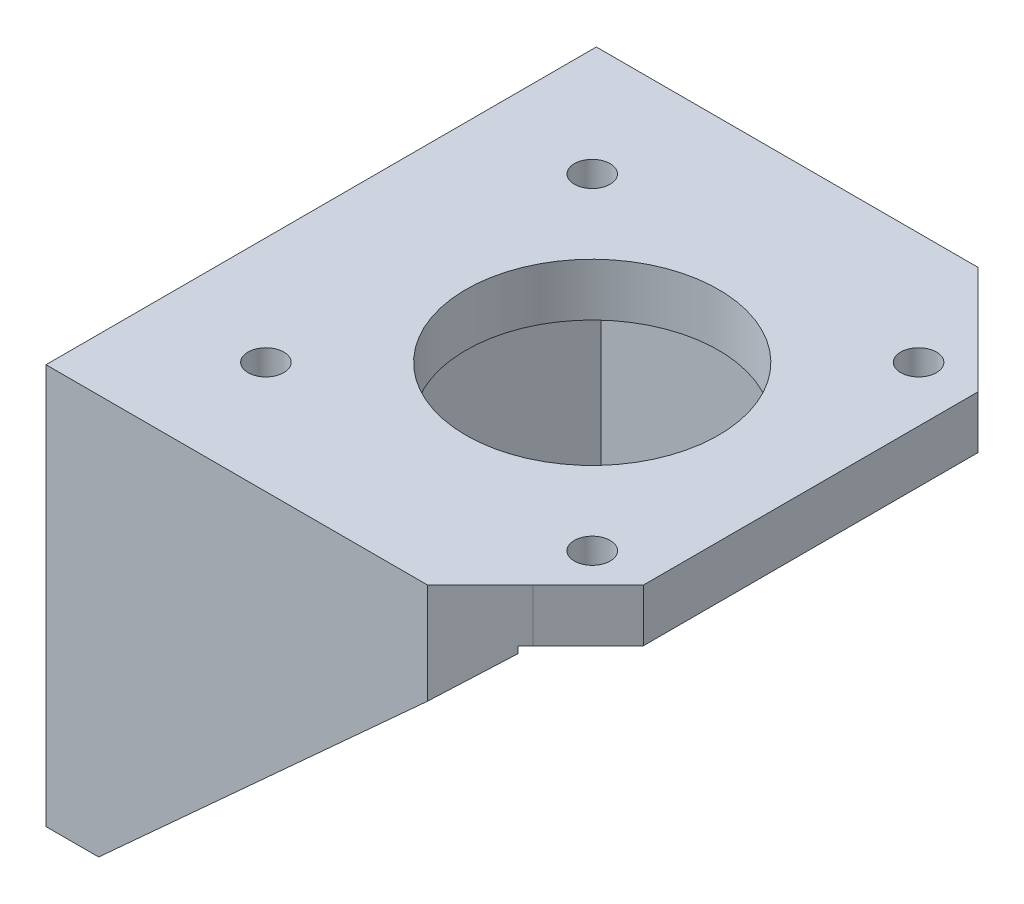
from build123d import *

# Parameters (mm, degrees)
SKETCH1_R                = 12
SKETCH1_R_2              = 1.7
BOSS_EXTRUDE1_DEPTH      = 5
BOSS_EXTRUDE3_DEPTH      = 5
BOSS_EXTRUDE4_DEPTH      = 5
CHAMFER1_SIZE            = 5
CHAMFER1_OF_MIRROR1_SIZE = 5
SKETCH7_R                = 3
CUT_EXTRUDE1_DEPTH       = 3.1
CUT_EXTRUDE2_DEPTH       = 33.001420077


# Read off the part's stored shape, not the designer's step: Cut-Extrude2
with BuildPart() as part:
    # Sketch1 → Boss-Extrude1 (new body)
    with BuildSketch(Plane(origin=(0, 0, 0), x_dir=(1, 0, 0), z_dir=(0, 1, 0))):
        Polygon((-20.75, 21.139640519), (-20.75, -21.139640519), (15.50680609, -21.139640519), (20.75, -15.896446609), (20.75, 15.896446609), (15.50680609, 21.139640519), align=None)
        with Locations(Location((0, 0, 0), (0, 0, 270))):
            Circle(SKETCH1_R, mode=Mode.SUBTRACT)
        with Locations(Location((15.5, 15.5, 0), (0, 0, 270))):
            Circle(SKETCH1_R_2, mode=Mode.SUBTRACT)
        with Locations(Location((-15.5, -15.5, 0), (0, 0, 270))):
            Circle(SKETCH1_R_2, mode=Mode.SUBTRACT)
        with Locations(Location((15.5, -15.5, 0), (0, 0, 270))):
            Circle(SKETCH1_R_2, mode=Mode.SUBTRACT)
        with Locations(Location((-15.5, 15.5, 0), (0, 0, 270))):
            Circle(SKETCH1_R_2, mode=Mode.SUBTRACT)
    extrude(amount=BOSS_EXTRUDE1_DEPTH)

    # Sketch3 → Boss-Extrude3 (add)
    with BuildSketch(Plane(origin=(-20.75, 0.364318818, 0), x_dir=(0, 0, 1), z_dir=(-1, 0, 0))):
        Polygon((-21.139640519, 4.635681182), (-21.139640519, 4.634261105), (-21.139640519, -0.364318818), (21.139640519, -0.364318818), (21.139640519, 4.634261105), (21.139640519, 4.635681182), align=None)
        with BuildLine():
            Line((21.139640519, -0.364318818), (-21.139640519, -0.364318818))
            Line((-21.139640519, -0.364318818), (-21.139640519, -5.366500535))
            Line((-21.139640519, -5.366500535), (-17.2, -5.366500535))
            ThreePointArc((-17.2, -5.366500535), (-15.5, -3.666500535), (-13.8, -5.366500535))
            Line((-13.8, -5.366500535), (13.8, -5.366500535))
            ThreePointArc((13.8, -5.366500535), (15.5, -3.666500535), (17.2, -5.366500535))
            Line((17.2, -5.366500535), (21.139640519, -5.366500535))
            Line((21.139640519, -5.366500535), (21.139640519, -0.364318818))
        make_face()
        with BuildLine():
            Line((-17.2, -5.366500535), (-21.139640519, -5.366500535))
            Line((-21.139640519, -5.366500535), (-21.139640519, -28.365738895))
            Line((-21.139640519, -28.365738895), (-17.2, -28.365738895))
            ThreePointArc((-17.2, -28.365738895), (-15.5, -26.665738895), (-13.8, -28.365738895))
            Line((-13.8, -28.365738895), (13.8, -28.365738895))
            ThreePointArc((13.8, -28.365738895), (15.5, -26.665738895), (17.2, -28.365738895))
            Line((17.2, -28.365738895), (21.139640519, -28.365738895))
            Line((21.139640519, -28.365738895), (21.139640519, -5.366500535))
            Line((21.139640519, -5.366500535), (17.2, -5.366500535))
            ThreePointArc((17.2, -5.366500535), (15.5, -7.066500535), (13.8, -5.366500535))
            Line((13.8, -5.366500535), (-13.8, -5.366500535))
            ThreePointArc((-13.8, -5.366500535), (-15.5, -7.066500535), (-17.2, -5.366500535))
        make_face()
        with BuildLine():
            Line((-17.2, -28.365738895), (-21.139640519, -28.365738895))
            Line((-21.139640519, -28.365738895), (-21.139640519, -33.365738895))
            Line((-21.139640519, -33.365738895), (21.139640519, -33.365738895))
            Line((21.139640519, -33.365738895), (21.139640519, -28.365738895))
            Line((21.139640519, -28.365738895), (17.2, -28.365738895))
            ThreePointArc((17.2, -28.365738895), (15.5, -30.065738895), (13.8, -28.365738895))
            Line((13.8, -28.365738895), (-13.8, -28.365738895))
            ThreePointArc((-13.8, -28.365738895), (-15.5, -30.065738895), (-17.2, -28.365738895))
        make_face()
    extrude(amount=BOSS_EXTRUDE3_DEPTH)

    # Sketch6 → Boss-Extrude4 (add)
    with BuildSketch(Plane(origin=(0, 0, -21.139640519), x_dir=(-1, 0, 0), z_dir=(0, 0, -1))):
        Polygon((-15.50680609, 0), (20.75, -33.001420077), (25.75, -33.001420077), (25.75, 5), (-15.50680609, 5), align=None)
    boss_extrude4 = extrude(amount=BOSS_EXTRUDE4_DEPTH)

    # Chamfer1
    chamfer1_edges = [part.edges().sort_by_distance(p)[0] for p in [
        (15.50680609, 2.5, -26.139640519),
    ]]
    chamfer(chamfer1_edges, length=CHAMFER1_SIZE - 0.0001)  # a hair under: the kernel refuses the full size

    # Mirror1: Boss-Extrude4 across plane
    add(boss_extrude4.mirror(Plane(origin=(0, 0, 0), x_dir=(1, 0, 0), z_dir=(0, 0, -1))))

    # Chamfer1 of Mirror1
    chamfer1_of_mirror1_edges = [part.edges().sort_by_distance(p)[0] for p in [
        (15.50680609, 2.5, 26.139640519),
    ]]
    chamfer(chamfer1_of_mirror1_edges, length=CHAMFER1_OF_MIRROR1_SIZE - 0.0001)  # a hair under: the kernel refuses the full size

    # Sketch7 → Cut-Extrude1 (cut)
    with BuildSketch(Plane(origin=(-20.75, 0, 0), x_dir=(0, 0, -1), z_dir=(1, 0, 0))):
        with Locations((-15.5, -5.002181717)):
            Circle(SKETCH7_R)
        with Locations((15.5, -5.002181717)):
            Circle(SKETCH7_R)
        with Locations((-15.5, -28.001420077)):
            Circle(SKETCH7_R)
        with Locations((15.5, -28.001420077)):
            Circle(SKETCH7_R)
    extrude(amount=-CUT_EXTRUDE1_DEPTH, mode=Mode.SUBTRACT)

    # Cut-Extrude2 outline → Cut-Extrude2 (cut)
    with BuildSketch(Plane.XZ):
        Polygon((-21, 21.846747301), (-21, -21.846747301), (17, -21.846747301), (17, -21.139640519), (-20.75, -21.139640519), (-20.75, 21.139640519), (17, 21.139640519), (17, 21.846747301), align=None)
    extrude(amount=CUT_EXTRUDE2_DEPTH, mode=Mode.SUBTRACT)


solid = part.part
